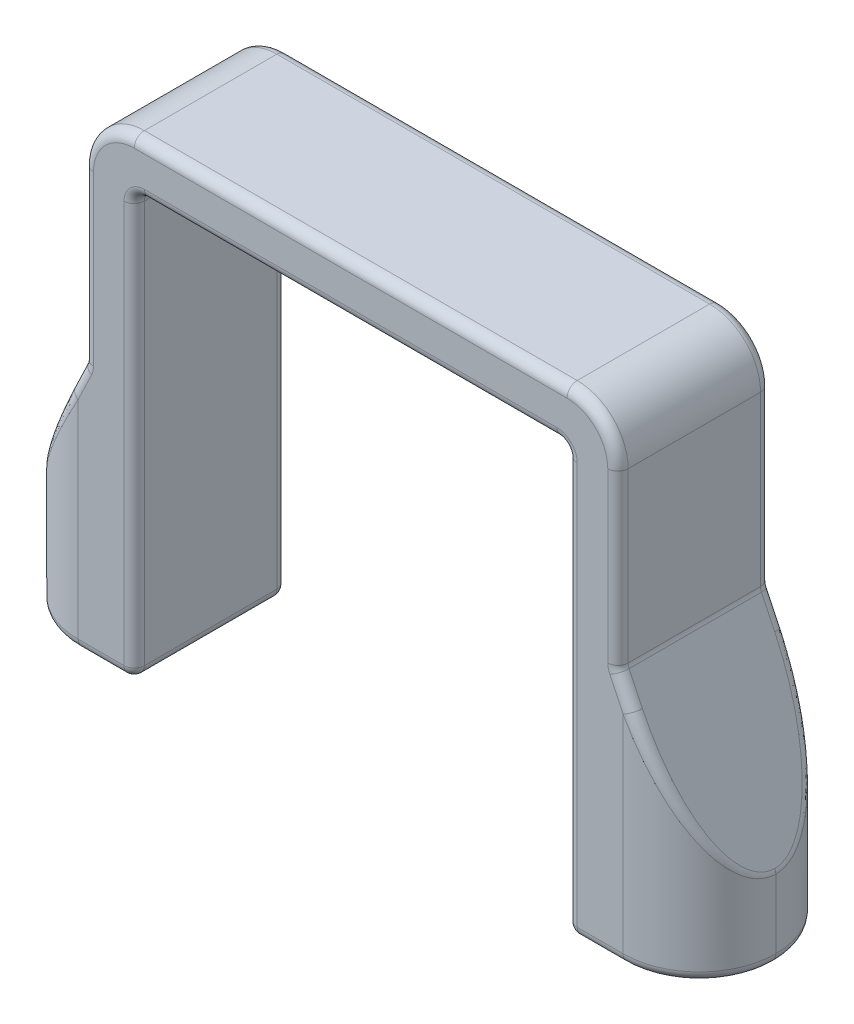
from build123d import *

# Parameters (mm, degrees)
SKETCH2_W           = 8
SKETCH2_H           = 8
BOSS_EXTRUDE1_DEPTH = 15
SKETCH3_R           = 3.25
CUT_EXTRUDE1_DEPTH  = 10
FILLET1_R           = 7.5
FILLET2_R           = 5
FILLET18_R          = 1


with BuildPart() as part:
    # Sketch2 → Boss-Extrude1 (new body)
    with BuildSketch(Plane.XY):
        with Locations((-30.25, -16.75)):
            Rectangle(SKETCH2_W, SKETCH2_H)
        Polygon((-26.25, -20.75), (-21.25, -20.75), (-21.25, 20.75), (-26.25, 20.75), (-26.25, 4), (-26.25, -12.75), align=None)
        Polygon((-26.25, 20.75), (-21.25, 20.75), (0, 20.75), (0, 25.75), (-26.25, 25.75), align=None)
        Polygon((21.25, 20.75), (26.25, 20.75), (26.25, 25.75), (0, 25.75), (0, 20.75), align=None)
        Polygon((21.25, -20.75), (26.25, -20.75), (26.25, -12.75), (26.25, 4), (26.25, 20.75), (21.25, 20.75), align=None)
        with Locations((30.25, -16.75)):
            Rectangle(SKETCH2_W, SKETCH2_H)
        Polygon((-34.25, -12.75), (-26.25, -12.75), (-26.25, 4), align=None)
        Polygon((26.25, -12.75), (34.25, -12.75), (26.25, 4), align=None)
    extrude(amount=BOSS_EXTRUDE1_DEPTH)

    # Sketch3 → Cut-Extrude1 (cut)
    with BuildSketch(Plane.XZ.offset(20.75)):
        with Locations(Location((-28.25, 7.5, 0), (0, 0, 270))):
            Circle(SKETCH3_R)
        with Locations(Location((28.25, 7.5, 0), (0, 0, 90))):
            Circle(SKETCH3_R)
    extrude(amount=-CUT_EXTRUDE1_DEPTH, mode=Mode.SUBTRACT)

    # Fillet1
    fillet1_edges = [part.edges().sort_by_distance(p)[0] for p in [
        (-34.25, -16.75, 0),
        (-34.25, -16.75, 15),
        (34.25, -16.75, 0),
        (34.25, -16.75, 15),
    ]]
    fillet(fillet1_edges, radius=FILLET1_R - 0.0001)  # a hair under: the kernel refuses the full size

    # Fillet2
    fillet2_edges = [part.edges().sort_by_distance(p)[0] for p in [
        (-26.25, 25.75, 7.5),
        (26.25, 25.75, 7.5),
    ]]
    fillet(fillet2_edges, radius=FILLET2_R)

    # Fillet18
    fillet18_edges = [part.edges().sort_by_distance(p)[0] for p in [
        (24.00005, -20.75, 0),
        (21.25, 0, 0),
        (0, 20.75, 0),
        (-21.25, 0, 0),
        (-24.00005, -20.75, 0),
        (-26.25, 12.375, 0),
        (21.25, -20.75, 7.5),
        (21.25, 20.75, 7.5),
        (-21.25, 20.75, 7.5),
        (-21.25, -20.75, 7.5),
        (-26.25, 4, 7.5),
        (26.25, 4, 7.5),
        (-26.25, 12.375, 15),
        (-24.00005, -20.75, 15),
        (-28.25, -20.75, 10.75),
        (28.25, -20.75, 4.25),
        (-21.25, 0, 15),
        (-26.50005, 3.476457812, 0),
        (-26.50005, 3.476457812, 15),
        (-31.077274949, -6.107106925, 1.374211715),
        (-31.077274949, -6.107106925, 13.625788285),
        (26.50005, 3.476457812, 15),
        (0, 20.75, 15),
        (-32.053330148, -20.75, 2.196669852),
        (-32.053330148, -20.75, 12.803330148),
        (26.50005, 3.476457812, 0),
        (31.077274944, -6.107106913, 1.374211711),
        (21.25, 0, 15),
        (31.077274944, -6.107106913, 13.625788289),
        (32.053330148, -20.75, 2.196669852),
        (32.053330148, -20.75, 12.803330148),
        (24.00005, -20.75, 15),
        (0, 25.75, 0),
        (0, 25.75, 15),
        (26.25, 12.375, 0),
        (-24.785533906, 24.285533906, 0),
        (24.785533906, 24.285533906, 0),
        (26.25, 12.375, 15),
        (-24.785533906, 24.285533906, 15),
        (24.785533906, 24.285533906, 15),
    ]]
    fillet(fillet18_edges, radius=FILLET18_R)


solid = part.part
